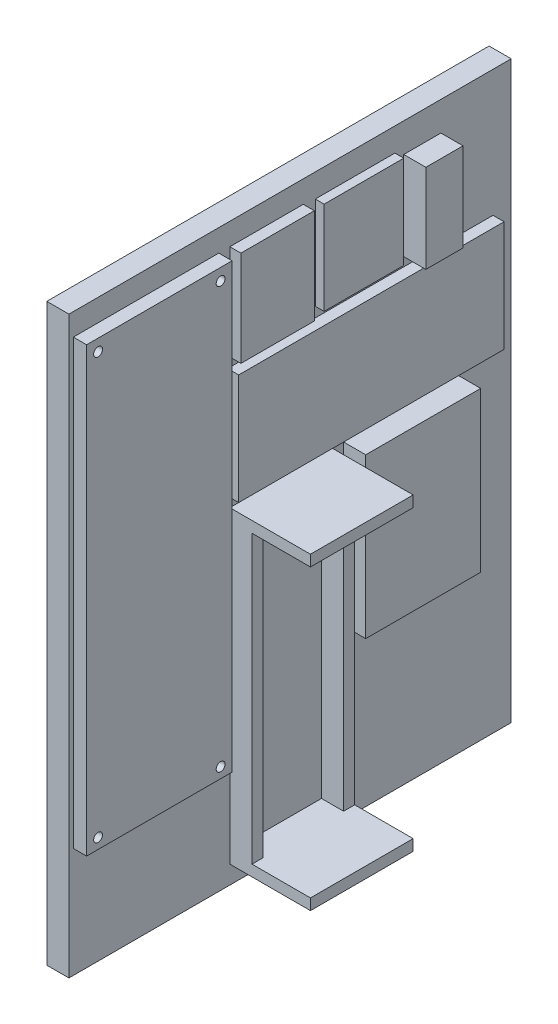
from build123d import *

# Parameters (mm, degrees)
SKETCH1_W            = 100
SKETCH1_H            = 130
SKETCH1_R            = 1
BOSS_EXTRUDE1_DEPTH  = 5
SKETCH3_W            = 32.89
SKETCH3_H            = 100.13
SKETCH3_R            = 1
BOSS_EXTRUDE3_DEPTH  = 3
SKETCH4_W            = 16.6
SKETCH4_H            = 21.6
BOSS_EXTRUDE4_DEPTH  = 2.5
SKETCH5_W            = 60
SKETCH5_H            = 25
BOSS_EXTRUDE5_DEPTH  = 2.5
SKETCH6_W            = 18
SKETCH6_H            = 21
BOSS_EXTRUDE6_DEPTH  = 2
SKETCH7_W            = 8.4
SKETCH7_H            = 20
BOSS_EXTRUDE7_DEPTH  = 5
SKETCH9_W            = 2.5
SKETCH9_H            = 64.8
BOSS_EXTRUDE8_DEPTH  = 5
SKETCH10_W           = 23.22
SKETCH10_H           = 2.5
BOSS_EXTRUDE9_DEPTH  = 18.22
SKETCH12_W           = 26
SKETCH12_H           = 36
BOSS_EXTRUDE11_DEPTH = 5
SKETCH11_W           = 26
SKETCH11_H           = 36
BOSS_EXTRUDE10_DEPTH = 5


with BuildPart() as part:
    # Sketch1 → Boss-Extrude1 (new body)
    with BuildSketch(Plane(origin=(0, 0, 0), x_dir=(0, 0, -1), z_dir=(1, 0, 0))):
        with Locations((32.555, -9.935)):
            Rectangle(SKETCH1_W, SKETCH1_H)
        with Locations((-13.855, -47.705)):
            Circle(SKETCH1_R, mode=Mode.SUBTRACT)
        with Locations((13.855, -47.705)):
            Circle(SKETCH1_R, mode=Mode.SUBTRACT)
        with Locations((-13.855, 47.395)):
            Circle(SKETCH1_R, mode=Mode.SUBTRACT)
        with Locations((13.855, 47.395)):
            Circle(SKETCH1_R, mode=Mode.SUBTRACT)
    extrude(amount=BOSS_EXTRUDE1_DEPTH)

    # Sketch3 → Boss-Extrude3 (add)
    with BuildSketch(Plane(origin=(5, 0, 0), x_dir=(0, 0, -1), z_dir=(1, 0, 0))):
        Rectangle(SKETCH3_W, SKETCH3_H)
        with Locations((-13.855, 47.395)):
            Circle(SKETCH3_R, mode=Mode.SUBTRACT)
        with Locations((13.855, 47.395)):
            Circle(SKETCH3_R, mode=Mode.SUBTRACT)
        with Locations((13.855, -47.705)):
            Circle(SKETCH3_R, mode=Mode.SUBTRACT)
        with Locations((-13.855, -47.705)):
            Circle(SKETCH3_R, mode=Mode.SUBTRACT)
    extrude(amount=BOSS_EXTRUDE3_DEPTH)

    # Sketch4 → Boss-Extrude4 (add)
    with BuildSketch(Plane(origin=(5, 0, 0), x_dir=(0, 0, -1), z_dir=(1, 0, 0))):
        with Locations((27.245, 39.265)):
            Rectangle(SKETCH4_W, SKETCH4_H)
    extrude(amount=BOSS_EXTRUDE4_DEPTH)

    # Sketch5 → Boss-Extrude5 (add)
    with BuildSketch(Plane(origin=(5, 0, 0), x_dir=(0, 0, -1), z_dir=(1, 0, 0))):
        with Locations((48.445, 13.965)):
            Rectangle(SKETCH5_W, SKETCH5_H)
    extrude(amount=BOSS_EXTRUDE5_DEPTH)

    # Sketch6 → Boss-Extrude6 (add)
    with BuildSketch(Plane(origin=(5, 0, 0), x_dir=(0, 0, -1), z_dir=(1, 0, 0))):
        with Locations((47.260487744, 39.246233232)):
            Rectangle(SKETCH6_W, SKETCH6_H)
    extrude(amount=BOSS_EXTRUDE6_DEPTH)

    # Sketch7 → Boss-Extrude7 (add)
    with BuildSketch(Plane(origin=(5, 0, 0), x_dir=(0, 0, -1), z_dir=(1, 0, 0))):
        with Locations((62.460487744, 38.465)):
            Rectangle(SKETCH7_W, SKETCH7_H)
    extrude(amount=BOSS_EXTRUDE7_DEPTH)

    # Sketch9 → Boss-Extrude8 (add)
    with BuildSketch(Plane(origin=(5, 0, 0), x_dir=(0, 0, -1), z_dir=(1, 0, 0))):
        with Locations((20.195, -35.935)):
            Rectangle(SKETCH9_W, SKETCH9_H)
        with Locations((40.915, -35.935)):
            Rectangle(SKETCH9_W, SKETCH9_H)
    extrude(amount=BOSS_EXTRUDE8_DEPTH)

    # Sketch10 → Boss-Extrude9 (add)
    with BuildSketch(Plane(origin=(5, 0, 0), x_dir=(0, 0, -1), z_dir=(1, 0, 0))):
        with Locations((30.555, -69.585)):
            Rectangle(SKETCH10_W, SKETCH10_H)
        with Locations((30.555, -2.285)):
            Rectangle(SKETCH10_W, SKETCH10_H)
    extrude(amount=BOSS_EXTRUDE9_DEPTH)

    # Sketch12 → Boss-Extrude11 (add)
    with BuildSketch(Plane(origin=(5, 0, 0), x_dir=(0, 0, -1), z_dir=(1, 0, 0))):
        with Locations((57.665, -19.035)):
            Rectangle(SKETCH12_W, SKETCH12_H)
    extrude(amount=BOSS_EXTRUDE11_DEPTH)

    # Sketch11 → Boss-Extrude10 (add)
    with BuildSketch(Plane(origin=(5, 0, 0), x_dir=(0, 0, -1), z_dir=(1, 0, 0))):
        with Locations((57.665, -19.035)):
            Rectangle(SKETCH11_W, SKETCH11_H)
    extrude(amount=BOSS_EXTRUDE10_DEPTH)


solid = part.part
